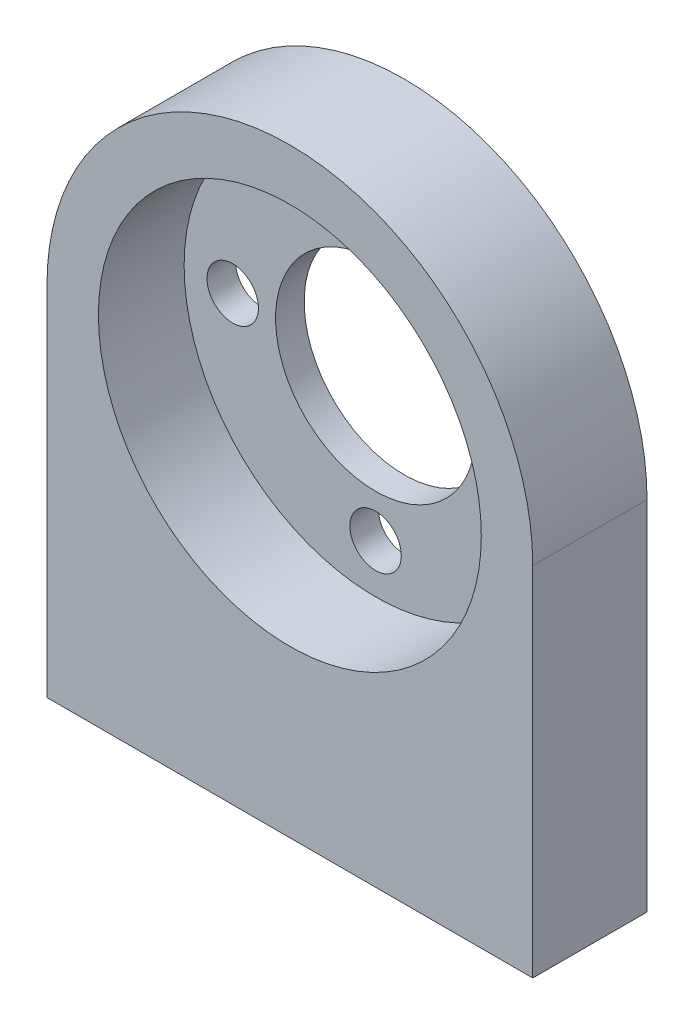
from build123d import *

# Parameters (mm, degrees)
ESQUISSE1_R             = 7
ESQUISSE1_R_2           = 1.8
BOSS_EXTRU_1_DEPTH      = 8
ESQUISSE2_R             = 13.4
ENL_V_MAT_EXTRU_1_DEPTH = 6
ESQUISSE3_R             = 2
ENL_V_MAT_EXTRU_2_DEPTH = 12
CHANFREIN1_SIZE         = 1


with BuildPart() as part:
    # Esquisse1 → Boss.-Extru.1 (new body)
    with BuildSketch(Plane.XY):
        with BuildLine():
            Line((-17, 0), (-17, -25))
            Line((-17, -25), (17, -25))
            Line((17, -25), (17, 0))
            ThreePointArc((17, 0), (0, 17), (-17, 0))
        make_face()
        Circle(ESQUISSE1_R, mode=Mode.SUBTRACT)
        with Locations((0, 10)):
            Circle(ESQUISSE1_R_2, mode=Mode.SUBTRACT)
        with Locations((10, 0)):
            Circle(ESQUISSE1_R_2, mode=Mode.SUBTRACT)
        with Locations((0, -10)):
            Circle(ESQUISSE1_R_2, mode=Mode.SUBTRACT)
        with Locations((-10, 0)):
            Circle(ESQUISSE1_R_2, mode=Mode.SUBTRACT)
    extrude(amount=BOSS_EXTRU_1_DEPTH)

    # Esquisse2 → Enlèv. mat.-Extru.1 (cut)
    with BuildSketch(Plane.XY.offset(8)):
        Circle(ESQUISSE2_R)
    extrude(amount=-ENL_V_MAT_EXTRU_1_DEPTH, mode=Mode.SUBTRACT)

    # Esquisse3 → Enlèv. mat.-Extru.2 (cut)
    with BuildSketch(Plane.XZ.offset(25)):
        with Locations((-12, 4)):
            Circle(ESQUISSE3_R)
        with Locations((12, 4)):
            Circle(ESQUISSE3_R)
    extrude(amount=-ENL_V_MAT_EXTRU_2_DEPTH, mode=Mode.SUBTRACT)

    # Chanfrein1
    chanfrein1_edges = [part.edges().sort_by_distance(p)[0] for p in [
        (10, -25, 4),
        (-14, -25, 4),
    ]]
    chamfer(chanfrein1_edges, length=CHANFREIN1_SIZE)


solid = part.part
